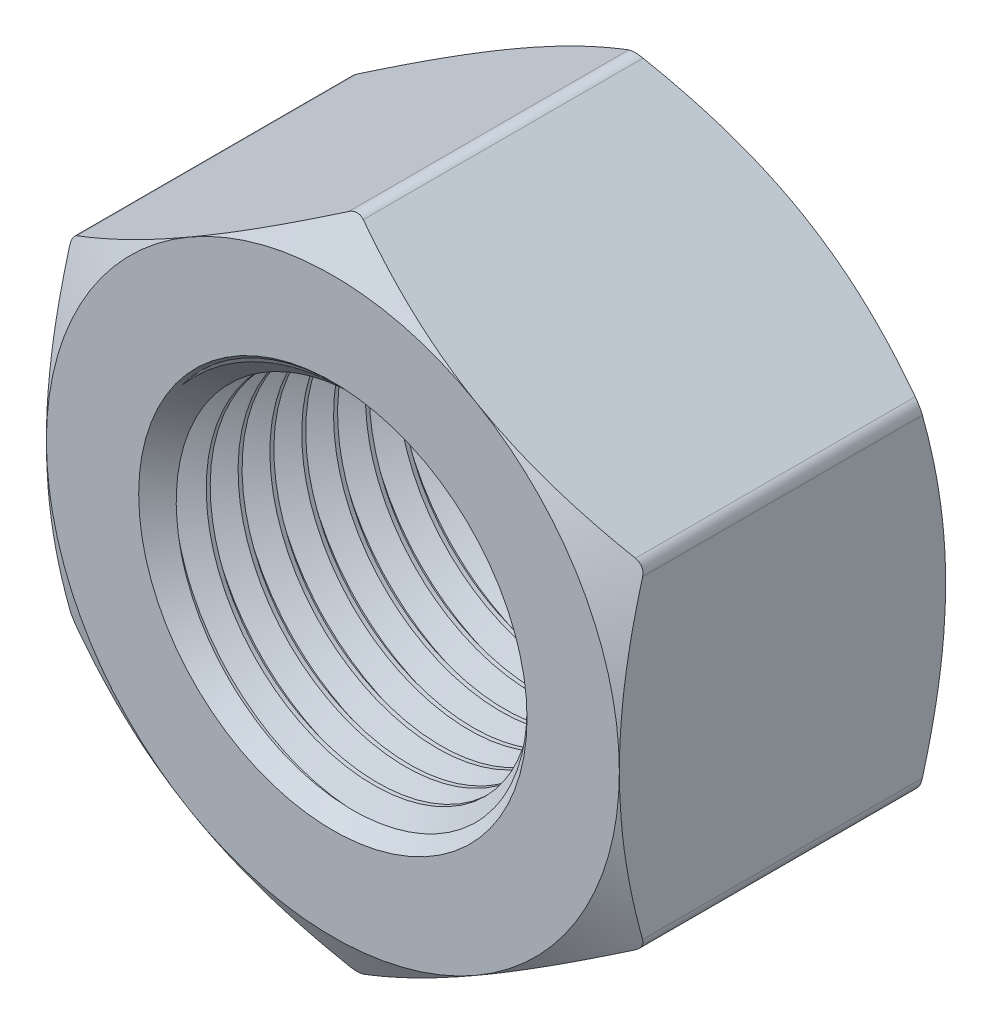
from build123d import *

# Parameters (mm, degrees)
BOSS_EXTRUDE2_DEPTH     = 8.1359375
CUT_EXTRUDE4_DEPTH      = 24.291694019
CUT_EXTRUDE4_DEPTH_BACK = 24.291694019
SKETCH16_R              = 9.525
SKETCH7_OUTSIDE_W       = 137.658
SKETCH7_OUTSIDE_H       = 142.08
SKETCH7_OUTSIDE_R       = 14.2875
CUT_EXTRUDE5_DEPTH      = 28.22284789
CUT_EXTRUDE5_DRAFT      = -60
MIRROR4_COPY_1_SKETCH_W = 137.658
MIRROR4_COPY_1_SKETCH_H = 142.08
MIRROR4_COPY_1_SKETCH_R = 14.2875
MIRROR4_COPY_1_DEPTH    = 28.22284789
MIRROR4_COPY_1_DRAFT    = -60
FILLET2_R               = 0.714375
SKETCH13_R              = 9.525
BOSS_EXTRUDE1_DEPTH     = 16.271875
CUT_SWEEP1_PITCH        = 1.5875
SKETCH17_R              = 9.525
BOSS_EXTRUDE3_DEPTH     = 16.271875


with BuildPart() as part:
    # Sketch15 → Boss-Extrude2 (new, symmetric)
    with BuildSketch(Plane.XY):
        Polygon((0, 16.497783942), (-14.2875, 8.248891971), (-14.2875, -8.248891971), (0, -16.497783942), (14.2875, -8.248891971), (14.2875, 8.248891971), align=None)
    extrude(amount=BOSS_EXTRUDE2_DEPTH, both=True)

    # Sketch16 → Cut-Extrude4 (cut, two sides: drawn at the far end of the back side and taken through both)
    with BuildSketch(Plane.XY.offset(-CUT_EXTRUDE4_DEPTH_BACK)):
        Circle(SKETCH16_R)
    extrude(amount=CUT_EXTRUDE4_DEPTH + CUT_EXTRUDE4_DEPTH_BACK, mode=Mode.SUBTRACT)


with BuildPart() as cut_extrude5_tool:
    # Sketch7 outside → Cut-Extrude5 (with draft: the straight prism first)
    with BuildSketch(Plane.XY.offset(8.1359375)):
        Rectangle(SKETCH7_OUTSIDE_W, SKETCH7_OUTSIDE_H)
        Circle(SKETCH7_OUTSIDE_R, mode=Mode.SUBTRACT)
    extrude(amount=-CUT_EXTRUDE5_DEPTH)
    # Cut-Extrude5: the draft: its side faces are tilted about the plane it starts from
    cut_extrude5_sides = [cut_extrude5_tool.faces().sort_by_distance(p)[0] for p in [
        (0, -71.04, -5.975486445),
        (68.829, 0, -5.975486445),
        (0, 71.04, -5.975486445),
        (-68.829, 0, -5.975486445),
        (-14.2875, 0, -5.975486445),
    ]]
    draft(cut_extrude5_sides, Plane.XY.offset(8.1359375), CUT_EXTRUDE5_DRAFT)


with BuildPart() as part_1:
    add(part.part)

    # Cut-Extrude5: cut by cut_extrude5_tool
    add(cut_extrude5_tool.part, mode=Mode.SUBTRACT)


with BuildPart() as mirror4_copy_1_tool:
    # Mirror4 copy 1 sketch → Mirror4 copy 1 (with draft: the straight prism first)
    with BuildSketch(Plane(origin=(0, 0, -8.1359375), x_dir=(1, 0, 0), z_dir=(0, 0, -1))):
        Rectangle(MIRROR4_COPY_1_SKETCH_W, MIRROR4_COPY_1_SKETCH_H)
        Circle(MIRROR4_COPY_1_SKETCH_R, mode=Mode.SUBTRACT)
    extrude(amount=-MIRROR4_COPY_1_DEPTH)
    # Mirror4 copy 1: the draft: its side faces are tilted about the plane it starts from
    mirror4_copy_1_sides = [mirror4_copy_1_tool.faces().sort_by_distance(p)[0] for p in [
        (0, -71.04, 5.975486445),
        (68.829, 0, 5.975486445),
        (0, 71.04, 5.975486445),
        (-68.829, 0, 5.975486445),
        (-14.2875, 0, 5.975486445),
    ]]
    draft(mirror4_copy_1_sides, Plane(origin=(0, 0, -8.1359375), x_dir=(1, 0, 0), z_dir=(0, 0, -1)), MIRROR4_COPY_1_DRAFT)


with BuildPart() as part_2:
    add(part_1.part)

    # Mirror4 copy 1: cut by mirror4_copy_1_tool
    add(mirror4_copy_1_tool.part, mode=Mode.SUBTRACT)

    # Fillet2
    fillet2_edges = [part_2.edges().sort_by_distance(p)[0] for p in [
        (-14.2875, 8.248891971, 0),
        (-14.2875, -8.248891971, 0),
        (0, -16.497783942, 0),
        (14.2875, -8.248891971, 0),
        (14.2875, 8.248891971, 0),
        (0, 16.497783942, 0),
    ]]
    fillet(fillet2_edges, radius=FILLET2_R)

    # Sketch17 → Boss-Extrude3 (add)
    with BuildSketch(Plane.XY.offset(8.1359375)):
        Circle(SKETCH17_R)
    extrude(amount=-BOSS_EXTRUDE3_DEPTH)


with BuildPart() as body_2:
    # Sketch13 → Boss-Extrude1 (new body)
    with BuildSketch(Plane(origin=(0, 0, -8.1359375), x_dir=(-1, 0, 0), z_dir=(0, 0, -1))):
        Circle(SKETCH13_R)
    extrude(amount=-BOSS_EXTRUDE1_DEPTH)

    # Cut-Sweep1: the profile of Sketch12 profile screwed along a right-hand helix of 11.25 turns, 8 arcs to a turn; built about Z, then put on its axis
    cut_sweep1_z = Axis((0, 0, 0), (0, 0, 1))
    cut_sweep1_corners = [(9.5253, 0, -1.389235705), (9.5253, 0, 0.000173205), (8.493888504, 0, -0.5953125), (8.493888504, 0, -0.79375)]
    with BuildLine(mode=Mode.PRIVATE) as cut_sweep1_profile:
        Line(cut_sweep1_corners[0], cut_sweep1_corners[1])
        Line(cut_sweep1_corners[1], cut_sweep1_corners[2])
        Line(cut_sweep1_corners[2], cut_sweep1_corners[3])
        Line(cut_sweep1_corners[3], cut_sweep1_corners[0])
    cut_sweep1_cap = Face(cut_sweep1_profile.wire())
    cut_sweep1_turn_angles = [0, 22.5, 45, 67.5, 90, 112.5, 135, 157.5, 180, 202.5, 225, 247.5, 270, 292.5, 315, 337.5, 360]
    cut_sweep1_turn_weights = [1, 0.9238795325112867, 1, 0.9238795325112867, 1, 0.9238795325112867, 1, 0.9238795325112867, 1, 0.9238795325112867, 1, 0.9238795325112867, 1, 0.9238795325112867, 1, 0.9238795325112867, 1]
    cut_sweep1_turn_rails = [Edge.make_bspline([Vector(p[0], p[1], 0).rotate(cut_sweep1_z, cut_sweep1_turn_angles[k]) / cut_sweep1_turn_weights[k] + Vector(0, 0, p[2] + CUT_SWEEP1_PITCH * cut_sweep1_turn_angles[k] / 360) for k in range(17)], [0, 0, 0, 1, 1, 2, 2, 3, 3, 4, 4, 5, 5, 6, 6, 7, 7, 8, 8, 8], 2, cut_sweep1_turn_weights) for p in cut_sweep1_corners]
    cut_sweep1_turn_sides = [Face.make_surface_from_curves(cut_sweep1_turn_rails[p[0]], cut_sweep1_turn_rails[p[1]]) for p in [(0, 1), (1, 2), (2, 3), (3, 0)]]
    cut_sweep1_last_angles = [3960, 3982.5, 4005, 4027.5, 4050]
    cut_sweep1_last_weights = [1, 0.9238795325112867, 1, 0.9238795325112898, 1]
    cut_sweep1_last_rails = [Edge.make_bspline([Vector(p[0], p[1], 0).rotate(cut_sweep1_z, cut_sweep1_last_angles[k]) / cut_sweep1_last_weights[k] + Vector(0, 0, p[2] + CUT_SWEEP1_PITCH * cut_sweep1_last_angles[k] / 360) for k in range(5)], [0, 0, 0, 1, 1, 2, 2, 2], 2, cut_sweep1_last_weights) for p in cut_sweep1_corners]
    cut_sweep1_last_sides = [Face.make_surface_from_curves(cut_sweep1_last_rails[p[0]], cut_sweep1_last_rails[p[1]]) for p in [(0, 1), (1, 2), (2, 3), (3, 0)]]
    cut_sweep1 = Plane(origin=(0, 0, -8.1359375), x_dir=(0, 1, 0), z_dir=(0, 0, 1)) * Solid(Shell([*[p.moved(Location((0, 0, CUT_SWEEP1_PITCH * i))) for i in range(11) for p in cut_sweep1_turn_sides], *cut_sweep1_last_sides, cut_sweep1_cap, cut_sweep1_cap.rotate(cut_sweep1_z, 4050).moved(Location((0, 0, CUT_SWEEP1_PITCH * 4050 / 360)))]))
    add(cut_sweep1, mode=Mode.SUBTRACT)


with BuildPart() as part_3:
    add(part_2.part)

    # Combine1: cut body 2
    add(body_2.part, mode=Mode.SUBTRACT)

    # Cut-Extrude2 cone 1 section (through the dimple's axis) → Cut-Extrude2 (revolve, cut)
    with BuildSketch(Plane(origin=(0, 0, 8.1359375), x_dir=(0, -1, 0), z_dir=(1, 0, 0))):
        Polygon((0, 0), (9.68375, 0), (0, 9.68375), align=None)
    revolve(axis=Axis((0, 0, 8.1359375), (0, 0, -1)), mode=Mode.SUBTRACT)

    # Cut-Extrude3 cone 1 section (through the dimple's axis) → Cut-Extrude3 (revolve, cut)
    with BuildSketch(Plane(origin=(0, 0, -8.1359375), x_dir=(0, 1, 0), z_dir=(1, 0, 0))):
        Polygon((0, 0), (9.68375, 0), (0, 9.68375), align=None)
    revolve(axis=Axis((0, 0, -8.1359375), (0, 0, 1)), mode=Mode.SUBTRACT)


solid = part_3.part
